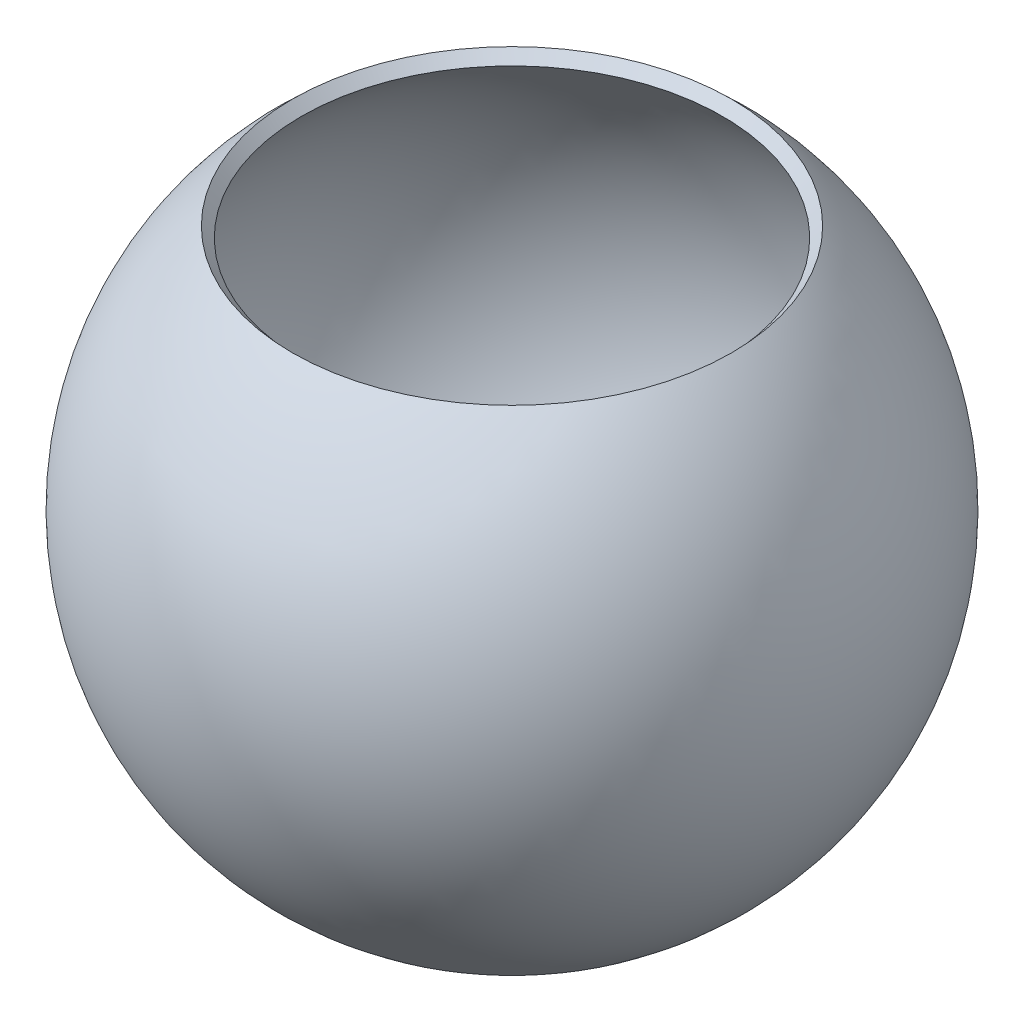
from build123d import *


with BuildPart() as part:
    # Sketch1 → Revolve1 (revolve)
    with BuildSketch(Plane.XY):
        with BuildLine():
            Line((0, -77.736301547), (0, -84.086301547))
            ThreePointArc((0, -84.086301547), (142.367867506, 13.934011971), (101.6, 181.90595171))
            Line((101.6, 181.90595171), (97.366666667, 177.172941157))
            ThreePointArc((97.366666667, 177.172941157), (136.435873027, 16.199832242), (0, -77.736301547))
        make_face()
    revolve(axis=Axis((0, 0, 0), (0, -1, 0)))


solid = part.part
